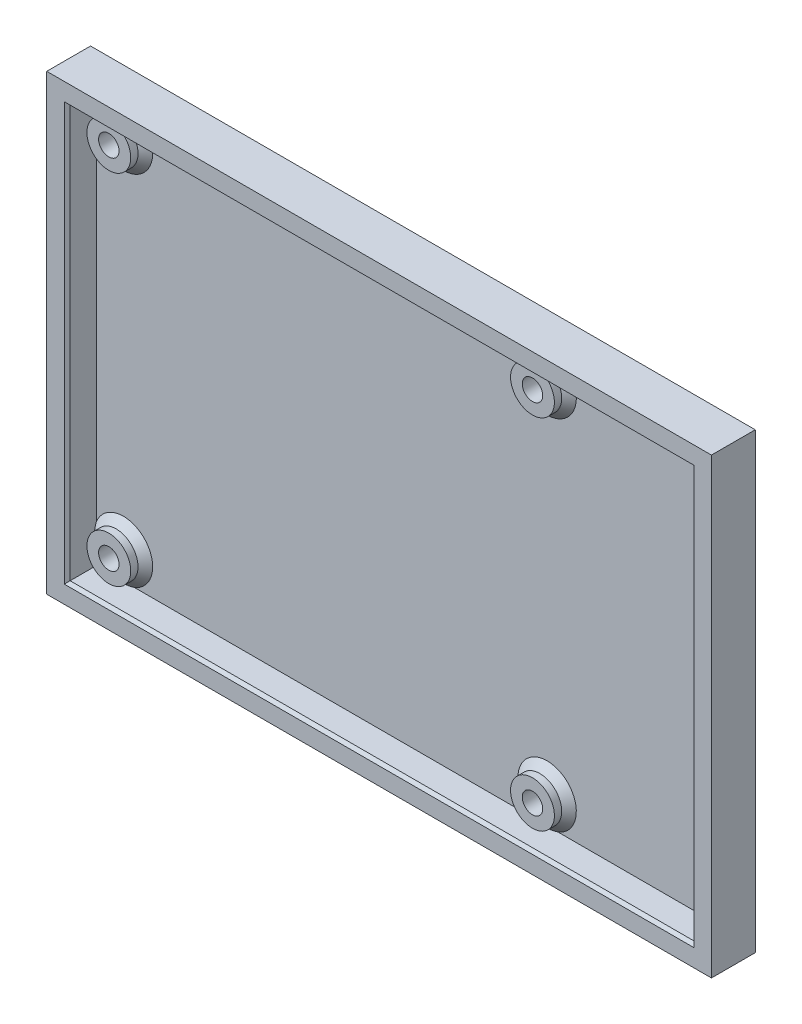
from build123d import *

# Parameters (mm, degrees)
SKETCH1_W                  = 91
SKETCH1_H                  = 62
BOSS_EXTRUDE1_DEPTH        = 6
SKETCH2_W                  = 85.4
SKETCH2_H                  = 56.4
CUT_EXTRUDE1_DEPTH         = 4
SKETCH3_R                  = 3
SKETCH3_R_2                = 1.4
BOSS_EXTRUDE2_DEPTH        = 2
CHAMFER1_SIZE              = 1
CHAMFER2_SIZE              = 0.4
LPATTERN1_COUNT            = 2
LPATTERN1_PITCH            = 58
LPATTERN1_COUNT_DIR2       = 2
LPATTERN1_PITCH_DIR2       = 49
CHAMFER1_OF_LPATTERN1_SIZE = 1


with BuildPart() as part:
    # Sketch1 → Boss-Extrude1 (new body)
    with BuildSketch(Plane.XY):
        Rectangle(SKETCH1_W, SKETCH1_H)
    extrude(amount=BOSS_EXTRUDE1_DEPTH)

    # Sketch2 → Cut-Extrude1 (cut)
    with BuildSketch(Plane.XY.offset(6)):
        Rectangle(SKETCH2_W, SKETCH2_H)
    extrude(amount=-CUT_EXTRUDE1_DEPTH, mode=Mode.SUBTRACT)

    # Sketch3 → Boss-Extrude2 (add)
    with BuildSketch(Plane.XY.offset(2)):
        with Locations(Location((-39, 24.5, 0), (0, 0, 180))):
            Circle(SKETCH3_R)
        with Locations((-39, 24.5)):
            Circle(SKETCH3_R_2, mode=Mode.SUBTRACT)
    boss_extrude2 = extrude(amount=BOSS_EXTRUDE2_DEPTH)

    # Chamfer1
    # the kernel refuses this chamfer: 1 mm, written as the material it adds along each edge
    with BuildSketch(Plane(origin=(-39, 24.5, 2), x_dir=(-1, 0, 0), z_dir=(0, 1, 0))) as chamfer1_piece_1:
        Polygon((3 + CHAMFER1_SIZE, 0), (3, CHAMFER1_SIZE), (3, 0), align=None)
    revolve(axis=Axis((-39, 24.5, 2), (0, 0, 1)))

    # Chamfer2
    chamfer2_edges = [part.edges().sort_by_distance(p)[0] for p in [
        (42.7, 0, 6),
        (0, 28.2, 6),
        (-42.7, 0, 6),
        (0, -28.2, 6),
    ]]
    chamfer(chamfer2_edges, length=CHAMFER2_SIZE)

    # LPattern1: Boss-Extrude2 2 × 2
    with Locations(*[(i * LPATTERN1_PITCH, -j * LPATTERN1_PITCH_DIR2, 0) for i in range(LPATTERN1_COUNT) for j in range(LPATTERN1_COUNT_DIR2) if (i, j) != (0, 0)]):
        add(boss_extrude2)

    # Chamfer1 of LPattern1
    # the kernel refuses this chamfer: 1 mm, written as the material it adds along each edge
    with BuildSketch(Plane(origin=(-39, -24.5, 2), x_dir=(-1, 0, 0), z_dir=(0, 1, 0))) as chamfer1_of_lpattern1_piece_1:
        Polygon((3 + CHAMFER1_OF_LPATTERN1_SIZE, 0), (3, CHAMFER1_OF_LPATTERN1_SIZE), (3, 0), align=None)
    revolve(axis=Axis((-39, -24.5, 2), (0, 0, 1)))
    with BuildSketch(Plane(origin=(19, 24.5, 2), x_dir=(-1, 0, 0), z_dir=(0, 1, 0))) as chamfer1_of_lpattern1_piece_2:
        Polygon((3 + CHAMFER1_OF_LPATTERN1_SIZE, 0), (3, CHAMFER1_OF_LPATTERN1_SIZE), (3, 0), align=None)
    revolve(axis=Axis((19, 24.5, 2), (0, 0, 1)))
    with BuildSketch(Plane(origin=(19, -24.5, 2), x_dir=(-1, 0, 0), z_dir=(0, 1, 0))) as chamfer1_of_lpattern1_piece_3:
        Polygon((3 + CHAMFER1_OF_LPATTERN1_SIZE, 0), (3, CHAMFER1_OF_LPATTERN1_SIZE), (3, 0), align=None)
    revolve(axis=Axis((19, -24.5, 2), (0, 0, 1)))


solid = part.part
